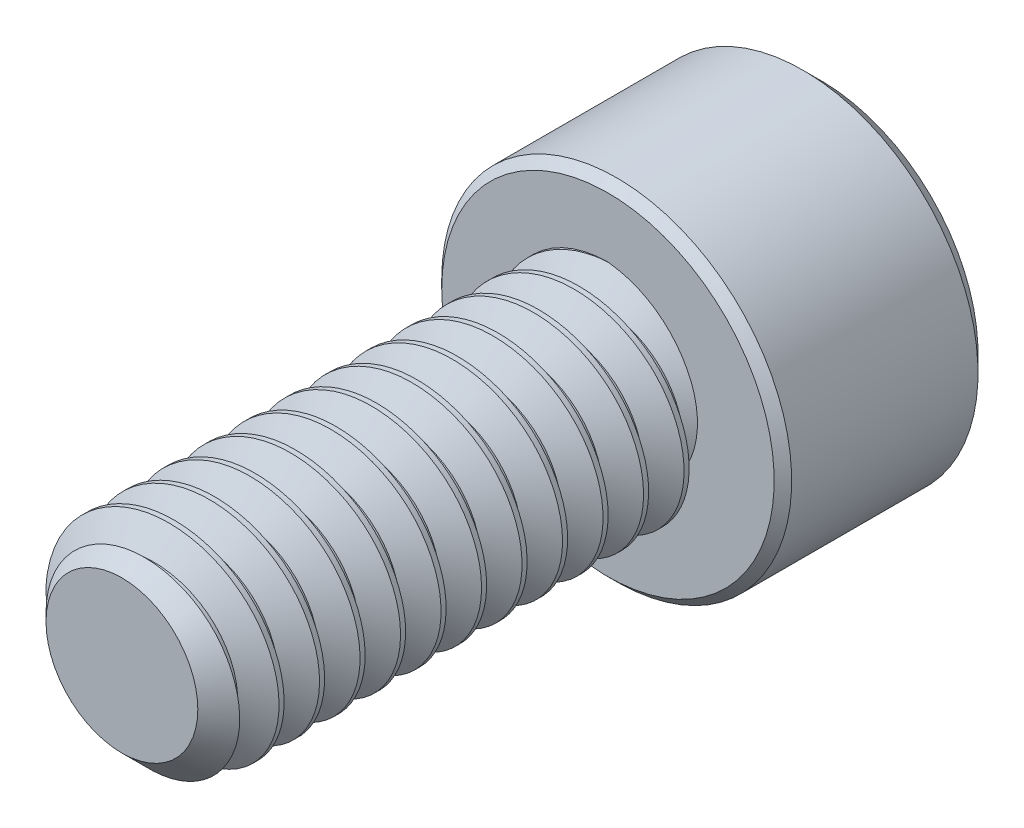
from build123d import *

# Parameters (mm, degrees)
SKETCH1_R          = 2.0828
EXTRUDE1_DEPTH     = 9.525
CHAMFER3_SIZE      = 0.5953125
CUT_SWEEP1_PITCH   = 0.79375
SKETCH6_R          = 3.429
EXTRUDE2_DEPTH     = 4.1656
CUT_EXTRUDE1_DEPTH = 2.67890625
CHAMFER1_SIZE      = 0.3429
CHAMFER2_SIZE      = 0.17145


with BuildPart() as part:
    # Sketch1 → Extrude1 (new body)
    with BuildSketch(Plane.XY):
        Circle(SKETCH1_R)
    extrude(amount=-EXTRUDE1_DEPTH)

    # Chamfer3
    chamfer3_edges = [part.edges().sort_by_distance(p)[0] for p in [
        (-2.0828, 0, 0),
    ]]
    chamfer(chamfer3_edges, length=CHAMFER3_SIZE)

    # Cut-Sweep1: the profile of Sketch3 profile screwed along a right-hand helix of 13 turns, 6 arcs to a turn; built about Z, then put on its axis
    cut_sweep1_z = Axis((0, 0, 0), (0, 0, 1))
    cut_sweep1_corners = [(2.0831, 0, -0.694704455), (1.567244252, 0, -0.396875), (1.567244252, 0, -0.29765625), (2.0831, 0, 0.000173205)]
    with BuildLine(mode=Mode.PRIVATE) as cut_sweep1_profile:
        Line(cut_sweep1_corners[0], cut_sweep1_corners[1])
        Line(cut_sweep1_corners[1], cut_sweep1_corners[2])
        Line(cut_sweep1_corners[2], cut_sweep1_corners[3])
        Line(cut_sweep1_corners[3], cut_sweep1_corners[0])
    cut_sweep1_cap = Face(cut_sweep1_profile.wire())
    cut_sweep1_turn_angles = [0, 30, 60, 90, 120, 150, 180, 210, 240, 270, 300, 330, 360]
    cut_sweep1_turn_weights = [1, 0.8660254037844387, 1, 0.8660254037844387, 1, 0.8660254037844387, 1, 0.8660254037844387, 1, 0.8660254037844387, 1, 0.8660254037844387, 1]
    cut_sweep1_turn_rails = [Edge.make_bspline([Vector(p[0], p[1], 0).rotate(cut_sweep1_z, cut_sweep1_turn_angles[k]) / cut_sweep1_turn_weights[k] + Vector(0, 0, p[2] + CUT_SWEEP1_PITCH * cut_sweep1_turn_angles[k] / 360) for k in range(13)], [0, 0, 0, 1, 1, 2, 2, 3, 3, 4, 4, 5, 5, 6, 6, 6], 2, cut_sweep1_turn_weights) for p in cut_sweep1_corners]
    cut_sweep1_turn_sides = [Face.make_surface_from_curves(cut_sweep1_turn_rails[p[0]], cut_sweep1_turn_rails[p[1]]) for p in [(0, 1), (1, 2), (2, 3), (3, 0)]]
    cut_sweep1 = Plane(origin=(0, 0, 0), x_dir=(0, 1, 0), z_dir=(0, 0, -1)) * Solid(Shell([*[p.moved(Location((0, 0, CUT_SWEEP1_PITCH * i))) for i in range(13) for p in cut_sweep1_turn_sides], cut_sweep1_cap, cut_sweep1_cap.rotate(cut_sweep1_z, 4680).moved(Location((0, 0, CUT_SWEEP1_PITCH * 4680 / 360)))]))
    add(cut_sweep1, mode=Mode.SUBTRACT)

    # Sketch6 → Extrude2 (add)
    with BuildSketch(Plane(origin=(0, 0, -9.525), x_dir=(-1, 0, 0), z_dir=(0, 0, -1))):
        Circle(SKETCH6_R)
    extrude(amount=EXTRUDE2_DEPTH)

    # Sketch7 → Cut-Extrude1 (cut)
    with BuildSketch(Plane(origin=(0, 0, -13.6906), x_dir=(-1, 0, 0), z_dir=(0, 0, -1))):
        Polygon((0, 2.062222993), (-1.7859375, 1.031111496), (-1.7859375, -1.031111496), (0, -2.062222993), (1.7859375, -1.031111496), (1.7859375, 1.031111496), align=None)
    extrude(amount=-CUT_EXTRUDE1_DEPTH, mode=Mode.SUBTRACT)

    # Cut-Extrude2 cone 1 section (through the dimple's axis) → Cut-Extrude2 (revolve, cut)
    with BuildSketch(Plane(origin=(0, 0, -13.6906), x_dir=(0, 1, 0), z_dir=(1, 0, 0))):
        Polygon((0, 0), (2.062222993, 0), (0, 2.062222993), align=None)
    revolve(axis=Axis((0, 0, -13.6906), (0, 0, 1)), mode=Mode.SUBTRACT)

    # Chamfer1
    chamfer1_edges = [part.edges().sort_by_distance(p)[0] for p in [
        (3.429, 0, -13.6906),
    ]]
    chamfer(chamfer1_edges, length=CHAMFER1_SIZE)

    # Chamfer2
    chamfer2_edges = [part.edges().sort_by_distance(p)[0] for p in [
        (3.429, 0, -9.525),
    ]]
    chamfer(chamfer2_edges, length=CHAMFER2_SIZE)


solid = part.part
